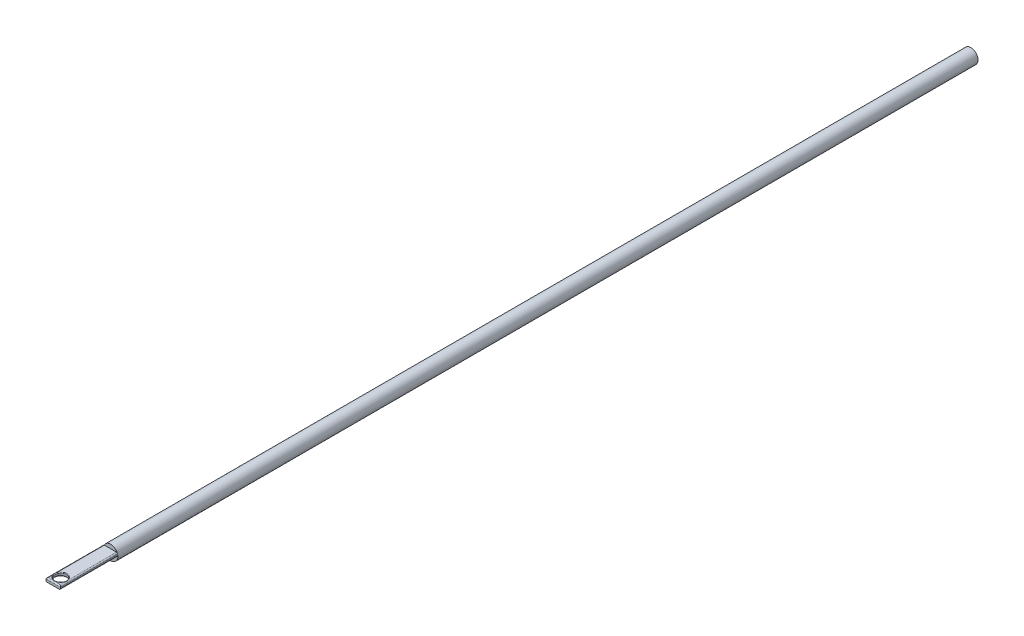
from build123d import *

# Parameters (mm, degrees)
SKETCH1_R           = 6.25
BOSS_EXTRUDE1_DEPTH = 750
SKETCH9_W           = 12.5
SKETCH9_H           = 50
SKETCH9_R           = 5
BOSS_EXTRUDE5_DEPTH = 3
FILLET3_R           = 1
FILLET5_R           = 0.5


# Some blends are built 0.0001 mm under size
with BuildPart() as part:
    # Sketch1 → Boss-Extrude1 (new body)
    with BuildSketch(Plane.XY):
        Circle(SKETCH1_R)
    extrude(amount=BOSS_EXTRUDE1_DEPTH)


with BuildPart() as body_2:
    # Sketch9 → Boss-Extrude5 (new body)
    with BuildSketch(Plane(origin=(0, 0, 0), x_dir=(1, 0, 0), z_dir=(0, 1, 0))):
        with Locations((0.06367686, -775.197871661)):
            Rectangle(SKETCH9_W, SKETCH9_H)
        with Locations(Location((-0.088854364, -793.497307476, 0), (0, 0, 270))):
            Circle(SKETCH9_R, mode=Mode.SUBTRACT)
    extrude(amount=BOSS_EXTRUDE5_DEPTH)

    # Fillet3
    # the kernel refuses this fillet: 1 mm, written as the material it takes off along each edge
    with BuildSketch(Plane(origin=(-0.088854364, 0, 793.497307476), x_dir=(0, 0, 1), z_dir=(-1, 0, 0))) as fillet3_piece_1:
        with BuildLine():
            CenterArc((5 + FILLET3_R, FILLET3_R), FILLET3_R, 180, 90)
            Line((5 + FILLET3_R, 0), (5, 0))
            Line((5, 0), (5, FILLET3_R))
        make_face()
    revolve(axis=Axis((-0.088854364, 0, 793.497307476), (0, 1, 0)), mode=Mode.SUBTRACT)
    with BuildSketch(Plane(origin=(-6.18632314, 3, 802.697871661), x_dir=(0, -1, 0), z_dir=(0, 0, -1)), Plane(origin=(6.31367686, 3, 747.697871661), x_dir=(0, -1, 0), z_dir=(0, 0, 1))) as fillet3_piece_2:
        with BuildLine():
            CenterArc((FILLET3_R, -FILLET3_R), FILLET3_R, 90, 90)
            Line((0, -FILLET3_R), (0, 0))
            Line((0, 0), (FILLET3_R, 0))
        make_face()
    extrude(amount=55, mode=Mode.SUBTRACT)
    with BuildSketch(Plane(origin=(8.81367686, 3, 800.197871661), x_dir=(0, -1, 0), z_dir=(-1, 0, 0))) as fillet3_piece_3:
        with BuildLine():
            CenterArc((FILLET3_R, -FILLET3_R), FILLET3_R, 90, 90)
            Line((0, -FILLET3_R), (0, 0))
            Line((0, 0), (FILLET3_R, 0))
        make_face()
    extrude(amount=17.5, mode=Mode.SUBTRACT)
    with BuildSketch(Plane(origin=(-6.18632314, 0, 802.697871661), x_dir=(0, 1, 0), z_dir=(0, 0, -1)), Plane(origin=(6.31367686, 0, 747.697871661), x_dir=(0, 1, 0), z_dir=(0, 0, 1))) as fillet3_piece_4:
        with BuildLine():
            CenterArc((FILLET3_R, FILLET3_R), FILLET3_R, 180, 90)
            Line((0, FILLET3_R), (0, 0))
            Line((0, 0), (FILLET3_R, 0))
        make_face()
    extrude(amount=55, mode=Mode.SUBTRACT)

    # Fillet5
    fillet5_edges = [body_2.edges().sort_by_distance(p)[0] for p in [
        (-0.088854364, 3, 788.497307476),
    ]]
    fillet(fillet5_edges, radius=FILLET5_R - 0.0004)  # a hair under: the kernel refuses the full size


solid = Compound([part.part, body_2.part])
